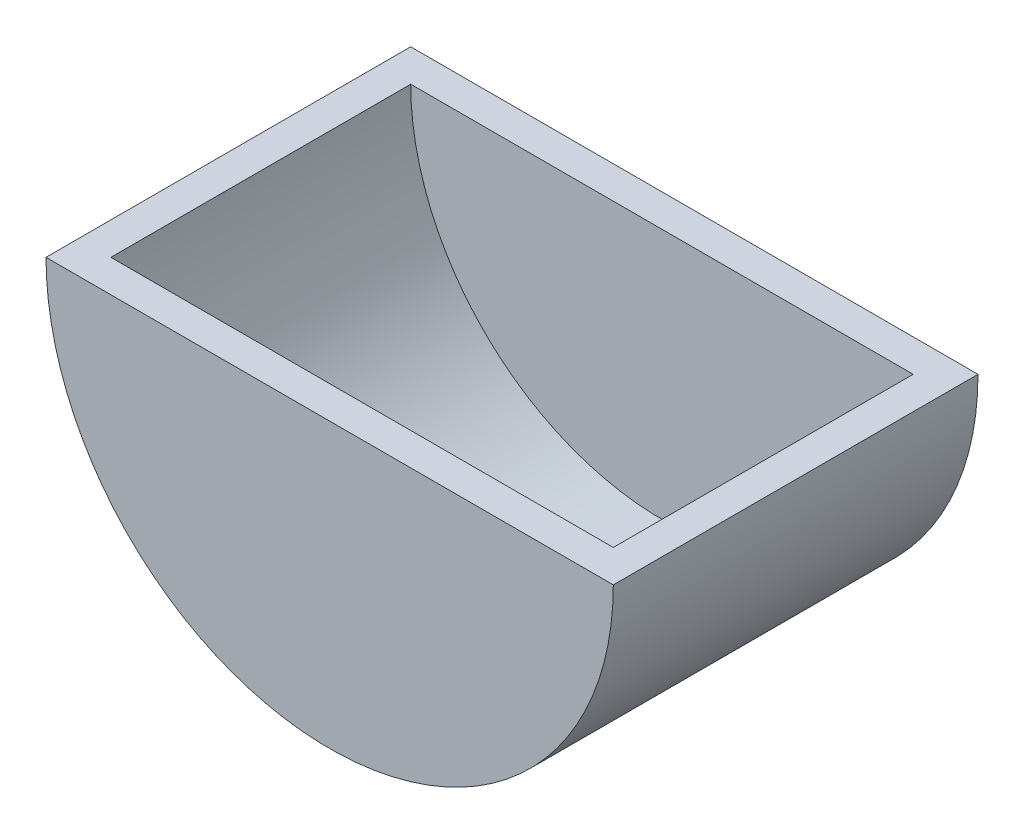
from build123d import *

# Parameters (mm, degrees)
BOSS_EXTRUDE1_DEPTH = 45
SKETCH2_W           = 31
SKETCH2_H           = 37


with BuildPart() as part:
    # Sketch1 → Boss-Extrude1 (new body)
    with BuildSketch(Plane.XY):
        with BuildLine():
            Line((35, 0), (-35, 0))
            ThreePointArc((-35, 0), (0, -35), (35, 0))
        make_face()
    extrude(amount=BOSS_EXTRUDE1_DEPTH)

    # Sketch2 → Cut-Revolve1 (revolve, cut)
    with BuildSketch(Plane(origin=(0, 0, 0), x_dir=(1, 0, 0), z_dir=(0, 1, 0))):
        with Locations((-15.5, -22.5)):
            Rectangle(SKETCH2_W, SKETCH2_H)
    revolve(axis=Axis((0, 0, 0), (0, 0, 1)), mode=Mode.SUBTRACT)


solid = part.part
